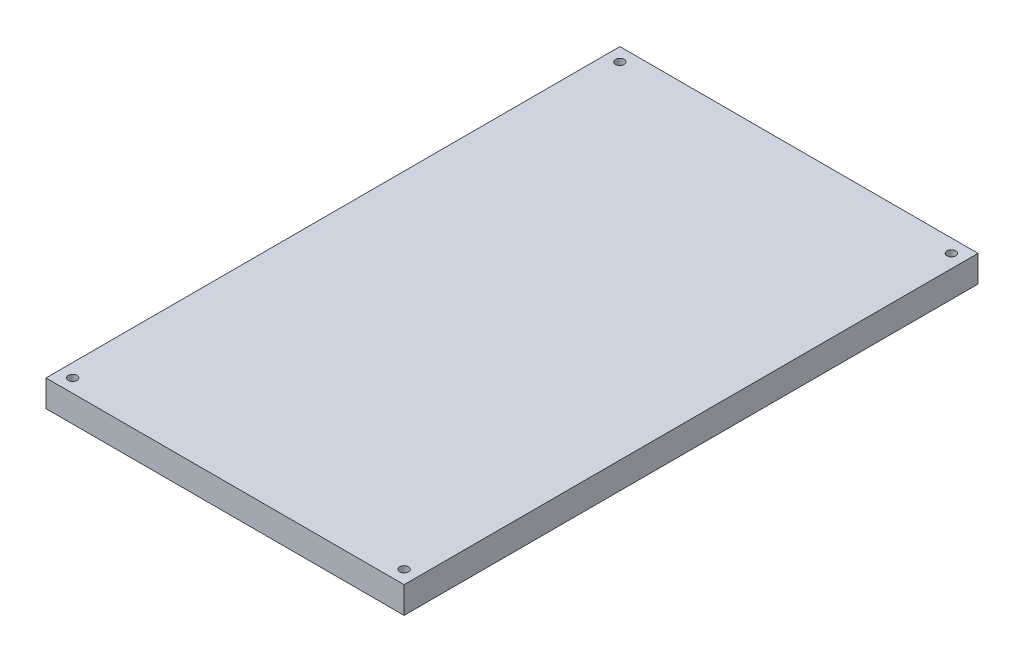
from build123d import *

# Parameters (mm, degrees)
SKETCH1_W               = 78
SKETCH1_H               = 125
BOSS_EXTRUDE1_DEPTH     = 5.8
SKETCH10_R              = 0.954996
CUT_EXTRUDE2_DEPTH      = 74.89783488
MIRROR2_COPY_1_SKETCH_R = 0.954996
MIRROR2_COPY_1_DEPTH    = 74.89783488


with BuildPart() as part:
    # Sketch1 → Boss-Extrude1 (new body)
    with BuildSketch(Plane(origin=(0, 25.000000038, 0), x_dir=(1, 0, 0), z_dir=(0, 1, 0))):
        Rectangle(SKETCH1_W, SKETCH1_H)
    extrude(amount=BOSS_EXTRUDE1_DEPTH)

    # Sketch10 → Cut-Extrude2 (cut, through all)
    with BuildSketch(Plane(origin=(0, 30.800000038, 0), x_dir=(1, 0, 0), z_dir=(0, 1, 0))):
        with Locations((-36.1, -59.6)):
            Circle(SKETCH10_R)
    cut_extrude2 = extrude(amount=-CUT_EXTRUDE2_DEPTH, mode=Mode.SUBTRACT)

    # Mirror1: Cut-Extrude2 across plane
    add(cut_extrude2.mirror(Plane(origin=(0, 0, 0), x_dir=(0, 0, 1), z_dir=(1, 0, 0))), mode=Mode.SUBTRACT)

    # Mirror2: Cut-Extrude2 across plane
    add(cut_extrude2.mirror(Plane.XY), mode=Mode.SUBTRACT)

    # Mirror2 copy 1 sketch → Mirror2 copy 1 (cut, through all)
    with BuildSketch(Plane(origin=(0, 30.800000038, 0), x_dir=(-1, 0, 0), z_dir=(0, 1, 0))):
        with Locations((-36.1, -59.6)):
            Circle(MIRROR2_COPY_1_SKETCH_R)
    extrude(amount=-MIRROR2_COPY_1_DEPTH, mode=Mode.SUBTRACT)


solid = part.part
